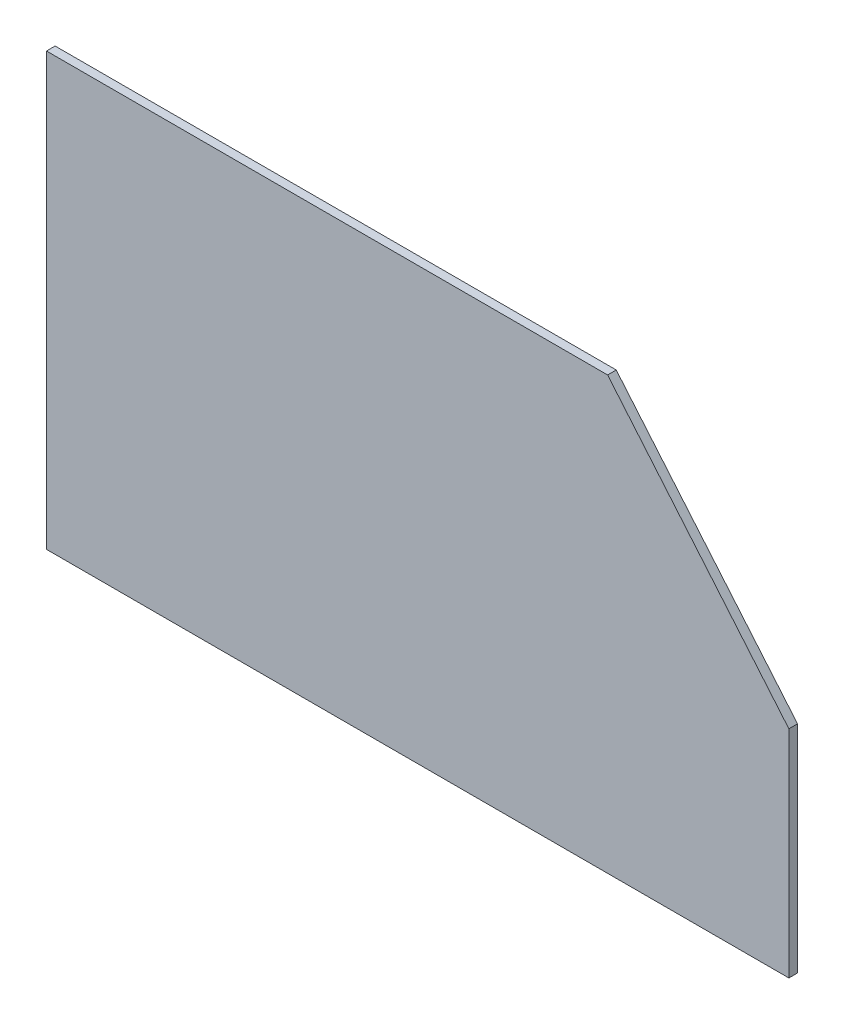
from build123d import *

# Parameters (mm, degrees)
BOSS_EXTRUDE1_DEPTH = 1


with BuildPart() as part:
    # Sketch1 → Boss-Extrude1 (new body)
    with BuildSketch(Plane.XY):
        Polygon((0, 0), (86, 0), (86, 25), (65, 50), (0, 50), align=None)
    extrude(amount=BOSS_EXTRUDE1_DEPTH)


solid = part.part
